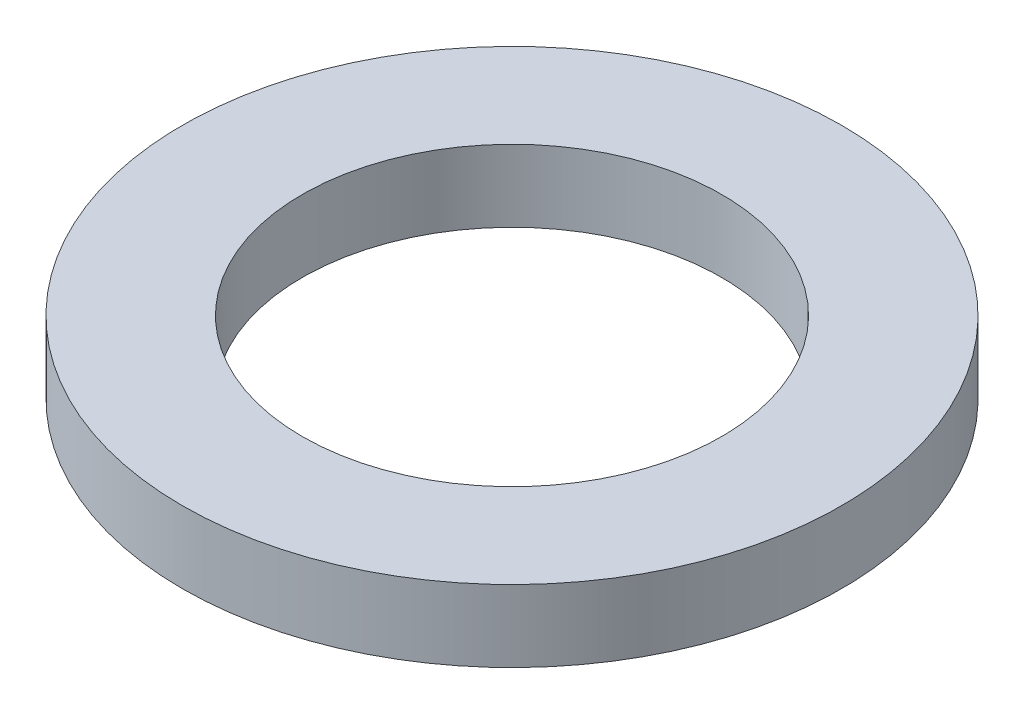
from build123d import *

# Parameters (mm, degrees)
SKETCH1_R           = 27.5
BOSS_EXTRUDE1_DEPTH = 6
SKETCH2_R           = 17.5
CUT_EXTRUDE1_DEPTH  = 40.35098474


with BuildPart() as part:
    # Sketch1 → Boss-Extrude1 (new body)
    with BuildSketch(Plane(origin=(0, 0, 0), x_dir=(1, 0, 0), z_dir=(0, 1, 0))):
        Circle(SKETCH1_R)
    extrude(amount=BOSS_EXTRUDE1_DEPTH)

    # Sketch2 → Cut-Extrude1 (cut, through all)
    with BuildSketch(Plane(origin=(0, 0, 0), x_dir=(1, 0, 0), z_dir=(0, 1, 0))):
        Circle(SKETCH2_R)
    extrude(amount=CUT_EXTRUDE1_DEPTH, mode=Mode.SUBTRACT)


solid = part.part
